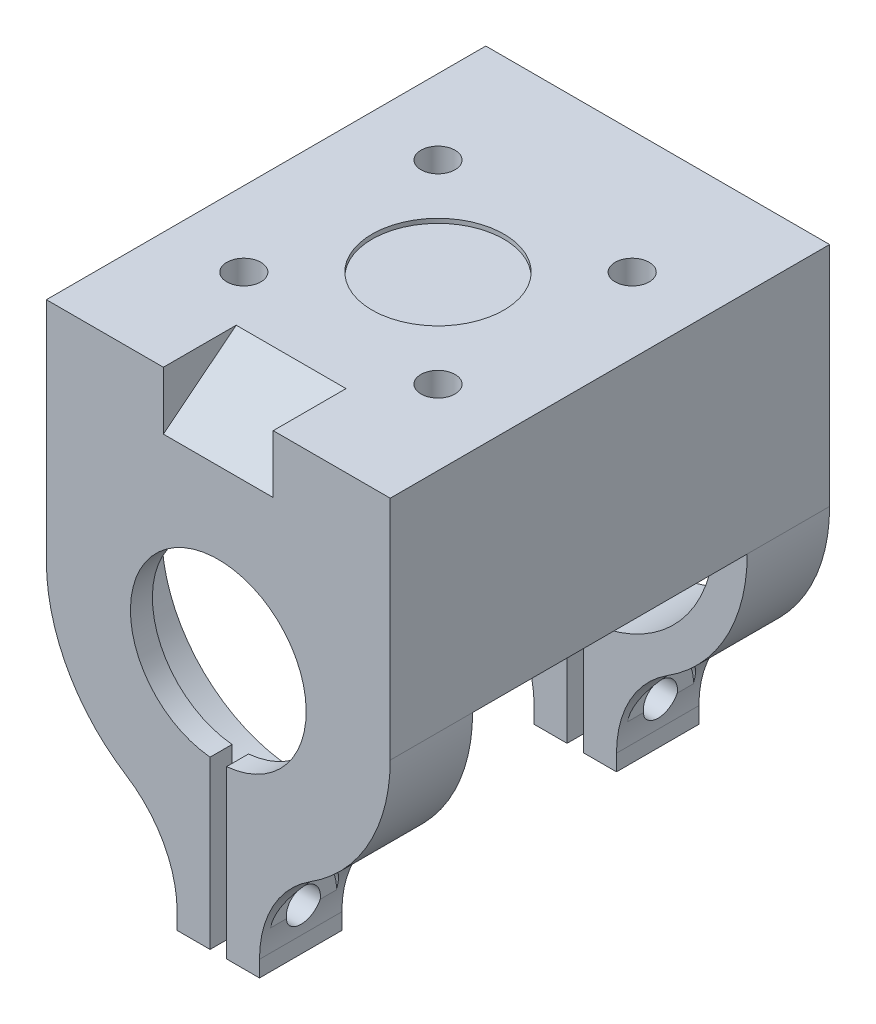
from build123d import *

# Parameters (mm, degrees)
BOSS_EXTRUDE1_DEPTH        = 20
SKETCH2_W                  = 3
SKETCH2_H                  = 10.5
BOSS_EXTRUDE2_DEPTH        = 20
SKETCH4_W                  = 31.3
SKETCH4_H                  = 40
BOSS_EXTRUDE3_DEPTH        = 5
SKETCH5_W                  = 25
SKETCH5_H                  = 23.127747226
CUT_EXTRUDE2_DEPTH         = 13.65
MOTORMOUNTHOLES_REACH      = 52.61
MOTORMOUNTHOLES_END_RADIUS = 12.65
SKETCH6_R                  = 1.55
CLAMPHOLES_REACH           = 38.211
SKETCH8_R                  = 1.55
ENDSTOPPER_DEPTH           = 2
CUT_EXTRUDE7_START         = -15.65
SKETCH10_W                 = 25
SKETCH10_H                 = 23.127747226
CUT_EXTRUDE7_DEPTH         = 13.65
SKETCH11_W                 = 25
SKETCH11_H                 = 10.636850541
CUT_EXTRUDE8_DEPTH         = 4
FILLET1_START              = -20
FILLET1_DEPTH              = 2.1999999
FILLET1_START_2            = -14.6999999
FILLET1_2_DEPTH            = 2.1999999
FILLET1_START_3            = 12.5
FILLET1_3_DEPTH            = 2.1999999
FILLET1_START_4            = 17.8000001
FILLET1_4_DEPTH            = 2.1999999
FILLET1_START_5            = -17.8000001
FILLET1_5_DEPTH            = 3.1000002
FILLET1_START_6            = 14.6999999
FILLET1_6_DEPTH            = 3.1000002
FILLET1_START_7            = -8.389376218
FILLET1_7_OUTLINE_R        = 1.55
FILLET1_7_DEPTH            = 16.778752436
SKETCH13_W                 = 10
SKETCH13_H                 = 10
CUT_EXTRUDE10_REACH        = 40.348
CUT_EXTRUDE10_START        = 4
SKETCH15_R                 = 3
CUT_EXTRUDE11_START        = -4
CUT_EXTRUDE11_DEPTH        = 3
SKETCH17_R                 = 6
SHAFT_CLEARANCE_DEPTH      = 0.4
SKETCH20_R                 = 2.8
CUT_EXTRUDE13_DEPTH        = 14.65


with BuildPart() as part:
    # Sketch1 → Boss-Extrude1 (new, symmetric)
    with BuildSketch(Plane.XY):
        with BuildLine():
            Line((-15.65, 15.65), (-15.65, 0))
            ThreePointArc((-15.65, 0), (-11.066221106, 11.066221145), (5.4e-08, 15.65))
            Line((5.4e-08, 15.65), (-15.65, 15.65))
        make_face()
        with BuildLine():
            Line((15.65, 15.65), (5.4e-08, 15.65))
            ThreePointArc((5.4e-08, 15.65), (11.066221145, 11.066221106), (15.65, 0))
            Line((15.65, 0), (15.65, 15.65))
        make_face()
        with BuildLine():
            ThreePointArc((5.4e-08, 15.65), (-11.066221106, 11.066221145), (-15.65, 0))
            ThreePointArc((-15.65, 0), (-11.328283189, -10.797800702), (-0.75, -15.632018424))
            Line((-0.75, -15.632018424), (-0.75, -12.627747226))
            ThreePointArc((-0.75, -12.627747226), (-8.675684411, 9.206247878), (12.65, 0))
            ThreePointArc((12.65, 0), (9.206247878, -8.675684411), (0.75, -12.627747226))
            Line((0.75, -12.627747226), (0.75, -15.632018424))
            ThreePointArc((0.75, -15.632018424), (11.328283189, -10.797800702), (15.65, 0))
            ThreePointArc((15.65, 0), (11.066221145, 11.066221106), (5.4e-08, 15.65))
        make_face()
    extrude(amount=BOSS_EXTRUDE1_DEPTH, both=True)

    # Sketch2 → Boss-Extrude2 (add, symmetric)
    with BuildSketch(Plane.XY):
        with Locations((-2.25, -17.877747226)):
            Rectangle(SKETCH2_W, SKETCH2_H)
        with Locations((2.25, -17.877747226)):
            Rectangle(SKETCH2_W, SKETCH2_H)
    extrude(amount=BOSS_EXTRUDE2_DEPTH, both=True)

    # Sketch4 → Boss-Extrude3 (add)
    with BuildSketch(Plane(origin=(0, 15.65, 0), x_dir=(1, 0, 0), z_dir=(0, 1, 0))):
        Rectangle(SKETCH4_W, SKETCH4_H)
    extrude(amount=BOSS_EXTRUDE3_DEPTH)

    # Sketch5 → Cut-Extrude2 (cut)
    with BuildSketch(Plane(origin=(15.65, 0, 0), x_dir=(0, 0, -1), z_dir=(1, 0, 0))):
        with Locations((0, -11.563873613)):
            Rectangle(SKETCH5_W, SKETCH5_H)
    extrude(amount=-CUT_EXTRUDE2_DEPTH, mode=Mode.SUBTRACT)

    # MotorMountHoles: up to this cylinder (the profile starts outside it)
    motormountholes_end = Plane(origin=(0, 0, 0), z_dir=(0, 0, -1)) * Cylinder(MOTORMOUNTHOLES_END_RADIUS, 149.19767, mode=Mode.PRIVATE)
    # Sketch6 → MotorMountHoles (cut, up to the surface)
    with BuildSketch(Plane(origin=(0, 20.65, 0), x_dir=(1, 0, 0), z_dir=(0, 1, 0)), mode=Mode.PRIVATE) as motormountholes_sk1:
        with Locations(Location((-8.838834765, 8.838834765, 0), (0, 0, 270))):
            Circle(SKETCH6_R)
    motormountholes_tool1 = extrude(motormountholes_sk1.sketch, amount=-MOTORMOUNTHOLES_REACH, mode=Mode.PRIVATE) - motormountholes_end
    add(motormountholes_tool1.solids().sort_by_distance((-8.838835, 20.65, -8.838835))[0], mode=Mode.SUBTRACT)
    # Sketch6 → MotorMountHoles (cut, up to the surface)
    with BuildSketch(Plane(origin=(0, 20.65, 0), x_dir=(1, 0, 0), z_dir=(0, 1, 0)), mode=Mode.PRIVATE) as motormountholes_sk2:
        with Locations(Location((8.838834765, 8.838834765, 0), (0, 0, 270))):
            Circle(SKETCH6_R)
    motormountholes_tool2 = extrude(motormountholes_sk2.sketch, amount=-MOTORMOUNTHOLES_REACH, mode=Mode.PRIVATE) - motormountholes_end
    add(motormountholes_tool2.solids().sort_by_distance((8.838835, 20.65, -8.838835))[0], mode=Mode.SUBTRACT)
    # Sketch6 → MotorMountHoles (cut, up to the surface)
    with BuildSketch(Plane(origin=(0, 20.65, 0), x_dir=(1, 0, 0), z_dir=(0, 1, 0)), mode=Mode.PRIVATE) as motormountholes_sk3:
        with Locations(Location((8.838834765, -8.838834765, 0), (0, 0, 270))):
            Circle(SKETCH6_R)
    motormountholes_tool3 = extrude(motormountholes_sk3.sketch, amount=-MOTORMOUNTHOLES_REACH, mode=Mode.PRIVATE) - motormountholes_end
    add(motormountholes_tool3.solids().sort_by_distance((8.838835, 20.65, 8.838835))[0], mode=Mode.SUBTRACT)
    # Sketch6 → MotorMountHoles (cut, up to the surface)
    with BuildSketch(Plane(origin=(0, 20.65, 0), x_dir=(1, 0, 0), z_dir=(0, 1, 0)), mode=Mode.PRIVATE) as motormountholes_sk4:
        with Locations(Location((-8.838834765, -8.838834765, 0), (0, 0, 270))):
            Circle(SKETCH6_R)
    motormountholes_tool4 = extrude(motormountholes_sk4.sketch, amount=-MOTORMOUNTHOLES_REACH, mode=Mode.PRIVATE) - motormountholes_end
    add(motormountholes_tool4.solids().sort_by_distance((-8.838835, 20.65, 8.838835))[0], mode=Mode.SUBTRACT)

    # ClampHoles: up to this face of the body (flat: up to its plane)
    clampholes_end = Plane(part.part.faces().sort_by_distance((3.75, -19.16091251, 16.25))[0])
    # Sketch8 → ClampHoles (cut, up to the picked face)
    with BuildSketch(Plane.ZY.offset(3.75), mode=Mode.PRIVATE) as clampholes_sk1:
        with Locations(Location((16.25, -19.194077794, 0), (0, 0, 270))):
            Circle(SKETCH8_R)
    clampholes_tool1 = split(extrude(clampholes_sk1.sketch, amount=-CLAMPHOLES_REACH, mode=Mode.PRIVATE), bisect_by=clampholes_end, keep=Keep.BOTH, mode=Mode.PRIVATE)
    # Sketch8 → ClampHoles (cut, up to the picked face)
    with BuildSketch(Plane.ZY.offset(3.75), mode=Mode.PRIVATE) as clampholes_sk2:
        with Locations(Location((-16.25, -19.194077794, 0), (0, 0, 270))):
            Circle(SKETCH8_R)
    clampholes_tool2 = split(extrude(clampholes_sk2.sketch, amount=-CLAMPHOLES_REACH, mode=Mode.PRIVATE), bisect_by=clampholes_end, keep=Keep.BOTH, mode=Mode.PRIVATE)
    add(clampholes_tool1.solids().sort_by(Axis((-3.75, -19.194078, 16.25), (1, 0, 0)))[0], mode=Mode.SUBTRACT)
    add(clampholes_tool2.solids().sort_by(Axis((-3.75, -19.194078, -16.25), (1, 0, 0)))[0], mode=Mode.SUBTRACT)

    # Sketch9 → EndStopper (add)
    with BuildSketch(Plane.XY.offset(20)):
        with BuildLine():
            ThreePointArc((12.65, 0), (-8.675684411, 9.206247878), (-0.75, -12.627747226))
            Line((-0.75, -12.627747226), (-0.75, -7.964766161))
            ThreePointArc((-0.75, -7.964766161), (-5.385164807, 5.916079783), (8, 0))
            ThreePointArc((8, 0), (5.916079783, -5.385164807), (0.75, -7.964766161))
            Line((0.75, -7.964766161), (0.75, -12.627747226))
            ThreePointArc((0.75, -12.627747226), (9.206247878, -8.675684411), (12.65, 0))
        make_face()
    extrude(amount=-ENDSTOPPER_DEPTH)

    # Sketch10 → Cut-Extrude7 (cut)
    with BuildSketch(Plane(origin=(0, 0, 0), x_dir=(0, 0, -1), z_dir=(1, 0, 0)).offset(CUT_EXTRUDE7_START)):
        with Locations((0, -11.563873613)):
            Rectangle(SKETCH10_W, SKETCH10_H)
    extrude(amount=CUT_EXTRUDE7_DEPTH, mode=Mode.SUBTRACT)

    # Sketch11 → Cut-Extrude8 (cut)
    with BuildSketch(Plane.ZY.offset(2)):
        with Locations((0, -17.809321955)):
            Rectangle(SKETCH11_W, SKETCH11_H)
    extrude(amount=-CUT_EXTRUDE8_DEPTH, mode=Mode.SUBTRACT)

    # Fillet1: read off the stored shape, not the designer's step
    # Fillet1 outline → Fillet1 (add)
    with BuildSketch(Plane.XY.offset(FILLET1_START)):
        with BuildLine():
            Line((3.75, -15.194077794), (3.75, -21.653175287))
            ThreePointArc((3.75, -21.653175287), (4.986261134, -16.83686123), (8.389376218, -13.211391549))
            ThreePointArc((8.389376218, -13.211391549), (6.150111782, -14.39092162), (3.75, -15.194077794))
        make_face()
        with BuildLine():
            ThreePointArc((-3.75, -15.194077794), (-6.150111782, -14.39092162), (-8.389376218, -13.21139155))
            ThreePointArc((-8.389376218, -13.21139155), (-4.986261134, -16.83686123), (-3.75, -21.653175287))
            Line((-3.75, -21.653175287), (-3.75, -15.194077794))
        make_face()
    extrude(amount=FILLET1_DEPTH)

    # Fillet1 2 outline → Fillet1 2 (add)
    with BuildSketch(Plane.XY.offset(FILLET1_START_2)):
        with BuildLine():
            Line((3.75, -15.194077794), (3.75, -21.653175287))
            ThreePointArc((3.75, -21.653175287), (4.986261134, -16.83686123), (8.389376218, -13.211391549))
            ThreePointArc((8.389376218, -13.211391549), (6.150111782, -14.39092162), (3.75, -15.194077794))
        make_face()
        with BuildLine():
            ThreePointArc((-3.75, -15.194077794), (-6.150111782, -14.39092162), (-8.389376218, -13.21139155))
            ThreePointArc((-8.389376218, -13.21139155), (-4.986261134, -16.83686123), (-3.75, -21.653175287))
            Line((-3.75, -21.653175287), (-3.75, -15.194077794))
        make_face()
    extrude(amount=FILLET1_2_DEPTH)

    # Fillet1 3 outline → Fillet1 3 (add)
    with BuildSketch(Plane.XY.offset(FILLET1_START_3)):
        with BuildLine():
            Line((3.75, -15.194077794), (3.75, -21.653175287))
            ThreePointArc((3.75, -21.653175287), (4.986261134, -16.83686123), (8.389376218, -13.211391549))
            ThreePointArc((8.389376218, -13.211391549), (6.150111782, -14.39092162), (3.75, -15.194077794))
        make_face()
        with BuildLine():
            ThreePointArc((-3.75, -15.194077794), (-6.150111782, -14.39092162), (-8.389376218, -13.21139155))
            ThreePointArc((-8.389376218, -13.21139155), (-4.986261134, -16.83686123), (-3.75, -21.653175287))
            Line((-3.75, -21.653175287), (-3.75, -15.194077794))
        make_face()
    extrude(amount=FILLET1_3_DEPTH)

    # Fillet1 4 outline → Fillet1 4 (add)
    with BuildSketch(Plane.XY.offset(FILLET1_START_4)):
        with BuildLine():
            Line((3.75, -15.194077794), (3.75, -21.653175287))
            ThreePointArc((3.75, -21.653175287), (4.986261134, -16.83686123), (8.389376218, -13.211391549))
            ThreePointArc((8.389376218, -13.211391549), (6.150111782, -14.39092162), (3.75, -15.194077794))
        make_face()
        with BuildLine():
            ThreePointArc((-3.75, -15.194077794), (-6.150111782, -14.39092162), (-8.389376218, -13.21139155))
            ThreePointArc((-8.389376218, -13.21139155), (-4.986261134, -16.83686123), (-3.75, -21.653175287))
            Line((-3.75, -21.653175287), (-3.75, -15.194077794))
        make_face()
    extrude(amount=FILLET1_4_DEPTH)

    # Fillet1 5 outline → Fillet1 5 (add)
    with BuildSketch(Plane.XY.offset(FILLET1_START_5)):
        with BuildLine():
            Line((3.75, -15.194077794), (3.75, -21.653175287))
            ThreePointArc((3.75, -21.653175287), (4.986261134, -16.83686123), (8.389376218, -13.211391549))
            ThreePointArc((8.389376218, -13.211391549), (6.150111782, -14.39092162), (3.75, -15.194077794))
        make_face()
        with BuildLine():
            ThreePointArc((-3.75, -15.194077794), (-6.150111782, -14.39092162), (-8.389376218, -13.21139155))
            ThreePointArc((-8.389376218, -13.21139155), (-4.986261134, -16.83686123), (-3.75, -21.653175287))
            Line((-3.75, -21.653175287), (-3.75, -15.194077794))
        make_face()
    extrude(amount=FILLET1_5_DEPTH)

    # Fillet1 6 outline → Fillet1 6 (add)
    with BuildSketch(Plane.XY.offset(FILLET1_START_6)):
        with BuildLine():
            Line((3.75, -15.194077794), (3.75, -21.653175287))
            ThreePointArc((3.75, -21.653175287), (4.986261134, -16.83686123), (8.389376218, -13.211391549))
            ThreePointArc((8.389376218, -13.211391549), (6.150111782, -14.39092162), (3.75, -15.194077794))
        make_face()
        with BuildLine():
            ThreePointArc((-3.75, -15.194077794), (-6.150111782, -14.39092162), (-8.389376218, -13.21139155))
            ThreePointArc((-8.389376218, -13.21139155), (-4.986261134, -16.83686123), (-3.75, -21.653175287))
            Line((-3.75, -21.653175287), (-3.75, -15.194077794))
        make_face()
    extrude(amount=FILLET1_6_DEPTH)

    # Fillet1 7 outline → Fillet1 7 (cut)
    with BuildSketch(Plane.YZ.offset(FILLET1_START_7)):
        with Locations((-19.194077794, -16.25)):
            Circle(FILLET1_7_OUTLINE_R)
        with Locations((-19.194077794, 16.25)):
            Circle(FILLET1_7_OUTLINE_R)
    extrude(amount=FILLET1_7_DEPTH, mode=Mode.SUBTRACT)

    # Cut-Sweep1: sweep along a path in Sketch12
    with BuildLine(Plane(origin=(0, 0, 0), x_dir=(0, 0, -1), z_dir=(1, 0, 0))) as cut_sweep1_path:
        Line((-2.775739564, 34.353299637), (-30.459033802, 12.328988213))
    # Sketch13 → Cut-Sweep1 (sweep, cut)
    with BuildSketch(Plane(origin=(0, 11.963370534, -15.037269505), x_dir=(-1, 0, 0), z_dir=(0, 0.6225843191548198, -0.7825527238100508))):
        with Locations((0, 29.484397462)):
            Rectangle(SKETCH13_W, SKETCH13_H)
    sweep(path=cut_sweep1_path.line, mode=Mode.SUBTRACT)

    # Sketch15 → Cut-Extrude10 (cut, up to next)
    with BuildSketch(Plane(origin=(0, 0, 0), x_dir=(0, 0, -1), z_dir=(1, 0, 0)).offset(CUT_EXTRUDE10_START), mode=Mode.PRIVATE) as cut_extrude10_sk1:
        with Locations((16.25, -19.194077794)):
            Circle(SKETCH15_R)
    cut_extrude10_tool1 = extrude(cut_extrude10_sk1.sketch, amount=CUT_EXTRUDE10_REACH, mode=Mode.PRIVATE) & part.part
    cut_extrude10 = cut_extrude10_tool1.solids().sort_by_distance((4, -19.194078, -16.25))[0]
    add(cut_extrude10, mode=Mode.SUBTRACT)

    # Sketch16 → Cut-Extrude11 (cut)
    with BuildSketch(Plane(origin=(0, 0, 0), x_dir=(0, 0, -1), z_dir=(1, 0, 0)).offset(CUT_EXTRUDE11_START)):
        Polygon((12.959103466, -19.194077794), (14.604551733, -22.044077794), (17.895448267, -22.044077794), (19.540896534, -19.194077794), (17.895448267, -16.344077794), (14.604551733, -16.344077794), align=None)
    cut_extrude11 = extrude(amount=-CUT_EXTRUDE11_DEPTH, mode=Mode.SUBTRACT)

    # Mirror1: Cut-Extrude10, Cut-Extrude11 across plane
    add(cut_extrude10.mirror(Plane.XY), mode=Mode.SUBTRACT)
    add(cut_extrude11.mirror(Plane.XY), mode=Mode.SUBTRACT)

    # Sketch17 → Shaft Clearance (cut)
    with BuildSketch(Plane(origin=(0, 20.65, 0), x_dir=(1, 0, 0), z_dir=(0, 1, 0))):
        with Locations(Location((0, 0, 0), (0, 0, 270))):
            Circle(SKETCH17_R)
    extrude(amount=-SHAFT_CLEARANCE_DEPTH, mode=Mode.SUBTRACT)

    # Sketch20 → Cut-Extrude13 (cut)
    with BuildSketch(Plane(origin=(0, 0, 0), x_dir=(1, 0, 0), z_dir=(0, 1, 0))):
        with Locations(Location((-8.838834765, 8.838834765, 0), (0, 0, 90))):
            Circle(SKETCH20_R)
        with Locations(Location((8.838834765, 8.838834765, 0), (0, 0, 90))):
            Circle(SKETCH20_R)
        with Locations(Location((8.838834765, -8.838834765, 0), (0, 0, 90))):
            Circle(SKETCH20_R)
        with Locations(Location((-8.838834765, -8.838834765, 0), (0, 0, 90))):
            Circle(SKETCH20_R)
    extrude(amount=CUT_EXTRUDE13_DEPTH, mode=Mode.SUBTRACT)


solid = part.part
